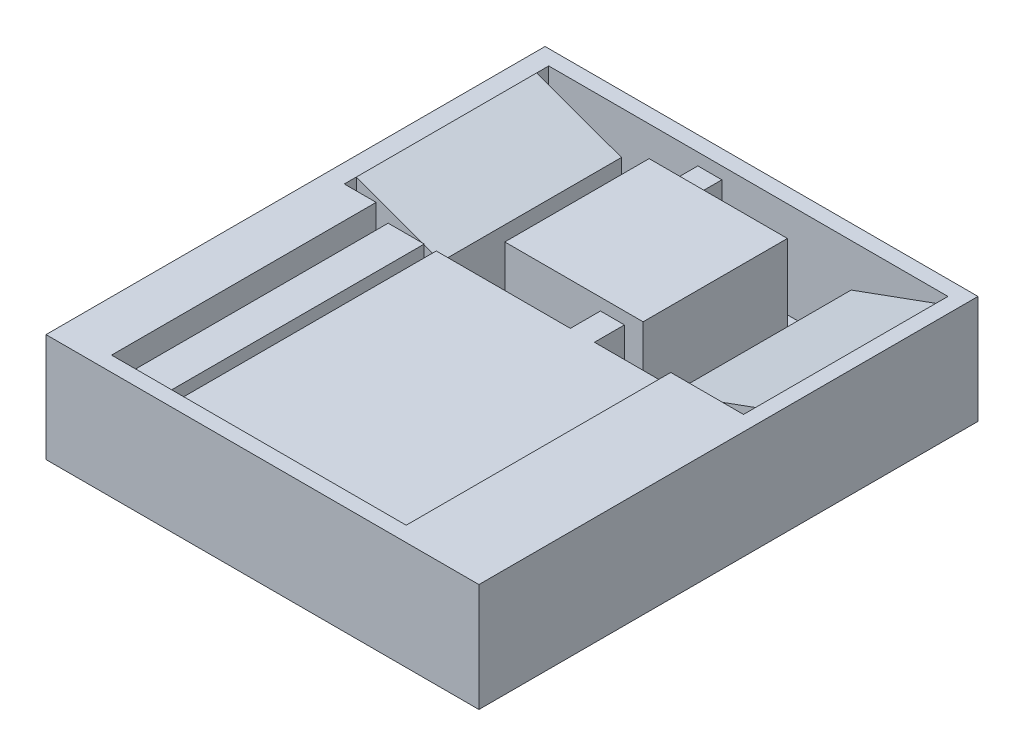
from build123d import *

# Parameters (mm, degrees)
SKETCH1_W           = 72
SKETCH1_H           = 83
BOSS_EXTRUDE1_DEPTH = 18
CAVITY2_START       = -80.5
CAVITY2_DEPTH       = 34
CAVITY2_START_2     = -48.5
CAVITY2_2_DEPTH     = 46
CAVITY2_3_DEPTH     = 5
CAVITY2_START_3     = -51.5
CAVITY2_4_DEPTH     = 5
CAVITY2_START_4     = -4.5
CAVITY2_5_OUTLINE_W = 37
CAVITY2_5_OUTLINE_H = 5
CAVITY2_5_DEPTH     = 2
CAVITY2_6_DEPTH     = 2
CAVITY2_7_DEPTH     = 2


# Read off the part's stored shape, not the designer's step: Cavity2
with BuildPart() as part:
    # Sketch1 → Boss-Extrude1 (new body)
    with BuildSketch(Plane(origin=(0, 0, 0), x_dir=(1, 0, 0), z_dir=(0, 1, 0))):
        with Locations((36, 41.5)):
            Rectangle(SKETCH1_W, SKETCH1_H)
    extrude(amount=BOSS_EXTRUDE1_DEPTH)

    # Cavity2 outline → Cavity2 (cut)
    with BuildSketch(Plane.XY.offset(CAVITY2_START)):
        Polygon((55.404610688, 2), (55.404610688, 12.86969785), (69.5, 18), (47.804610688, 18), (47.804610688, 2), align=None)
        Polygon((24.804610688, 18), (3.109221376, 18), (17.204610688, 12.86969785), (17.204610688, 2), (24.804610688, 2), align=None)
    extrude(amount=CAVITY2_DEPTH, mode=Mode.SUBTRACT)

    # Cavity2 2 outline → Cavity2 2 (cut)
    with BuildSketch(Plane.XY.offset(CAVITY2_START_2)):
        Polygon((55.404610688, 11), (57.404610688, 11), (57.404610688, 18), (8.404610688, 18), (8.404610688, 11), (10.404610688, 11), (10.404610688, 16), (16.404610688, 16), (16.404610688, 11), (18.404610688, 11), (18.404610688, 16), (55.404610688, 16), align=None)
    extrude(amount=CAVITY2_2_DEPTH, mode=Mode.SUBTRACT)

    # Cavity2 3 outline → Cavity2 3 (cut)
    with BuildSketch(Plane.XY.offset(CAVITY2_START)):
        Polygon((47.804610688, 2), (47.804610688, 18), (24.804610688, 18), (24.804610688, 2), (27.904610688, 2), (27.904610688, 16), (31.904610688, 16), (31.904610688, 2), align=None)
    extrude(amount=CAVITY2_3_DEPTH, mode=Mode.SUBTRACT)

    # Cavity2 4 outline → Cavity2 4 (cut)
    with BuildSketch(Plane.XY.offset(CAVITY2_START_3)):
        Polygon((47.804610688, 2), (47.804610688, 18), (24.804610688, 18), (24.804610688, 2), (40.704610688, 2), (40.704610688, 16), (44.704610688, 16), (44.704610688, 2), align=None)
    extrude(amount=CAVITY2_4_DEPTH, mode=Mode.SUBTRACT)

    # Cavity2 5 outline → Cavity2 5 (cut)
    with BuildSketch(Plane.XY.offset(CAVITY2_START_4)):
        with Locations((36.904610688, 13.5)):
            Rectangle(CAVITY2_5_OUTLINE_W, CAVITY2_5_OUTLINE_H)
    extrude(amount=CAVITY2_5_DEPTH, mode=Mode.SUBTRACT)

    # Cavity2 6 outline → Cavity2 6 (cut)
    with BuildSketch(Plane.XY.offset(CAVITY2_START)):
        Polygon((55.404610688, 7.548808988), (69.5, 12.679111138), (69.5, 18), (55.404610688, 12.86969785), align=None)
        Polygon((3.109221376, 18), (3.109221376, 12.679111138), (17.204610688, 7.548808988), (17.204610688, 12.86969785), align=None)
    extrude(amount=CAVITY2_6_DEPTH, mode=Mode.SUBTRACT)

    # Cavity2 7 outline → Cavity2 7 (cut)
    with BuildSketch(Plane.XY.offset(CAVITY2_START_2)):
        Polygon((55.404610688, 7.548808988), (69.5, 12.679111138), (69.5, 18), (57.404610688, 13.597638319), (57.404610688, 11), (55.404610688, 11), align=None)
        Polygon((8.404610688, 11), (8.404610688, 16.072635912), (3.109221376, 18), (3.109221376, 12.679111138), (17.204610688, 7.548808988), (17.204610688, 11), (16.404610688, 11), (16.404610688, 13.160874037), (10.404610688, 15.344695443), (10.404610688, 11), align=None)
    extrude(amount=CAVITY2_7_DEPTH, mode=Mode.SUBTRACT)


solid = part.part
